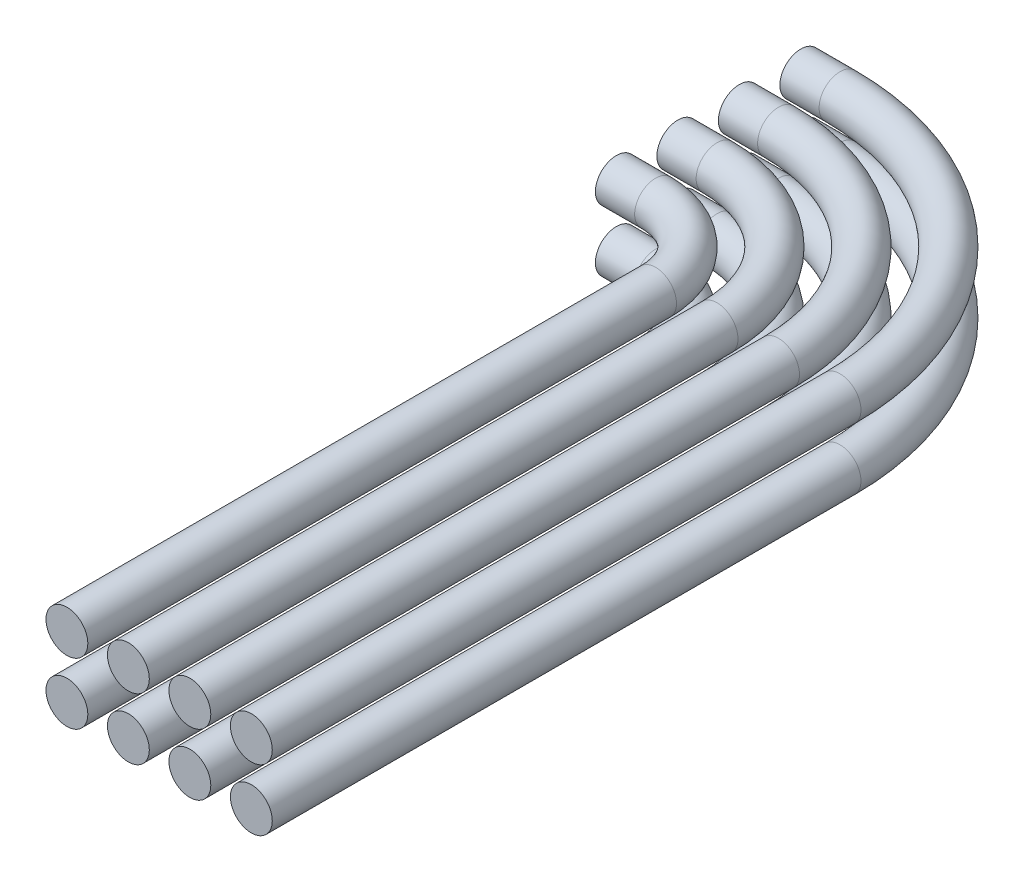
from build123d import *

# Parameters (mm, degrees)
SKETCH2_R       = 1.6
LPATTERN1_COUNT = 2
LPATTERN1_PITCH = 4.7


with BuildPart() as part:
    # Sweep1: sweep along a path in Sketch1
    with BuildLine(Plane(origin=(0, 0, 0), x_dir=(1, 0, 0), z_dir=(0, 1, 0))) as sweep1_path:
        Line((0, 0), (3, 0))
        ThreePointArc((3, 0), (17.142135624, -5.857864376), (23, -20))
        Line((23, -20), (23, -65))
    # Sketch2 → Sweep1 (sweep)
    with BuildSketch(Plane(origin=(0, 0, 0), x_dir=(0, 0, -1), z_dir=(1, 0, 0))):
        Circle(SKETCH2_R)
        with Locations((-4.7, 0)):
            Circle(SKETCH2_R)
        with Locations((-9.4, 0)):
            Circle(SKETCH2_R)
        with Locations((-14.1, 0)):
            Circle(SKETCH2_R)
    sweep1 = sweep(path=sweep1_path.line)


with BuildPart() as lpattern1_1:
    # LPattern1: Sweep1 ×2
    with Locations(*[(0, i * LPATTERN1_PITCH, 0) for i in range(1, LPATTERN1_COUNT)]):
        add(sweep1)


solid = Compound([part.part, lpattern1_1.part])
